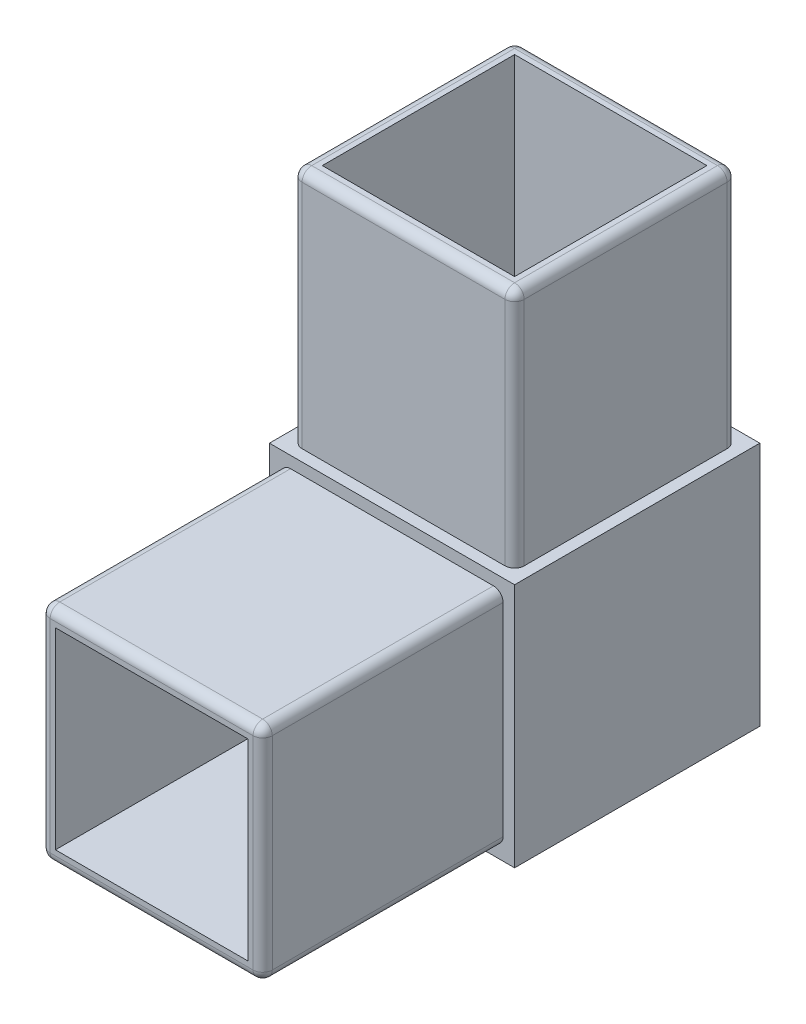
from build123d import *

# Parameters (mm, degrees)
SKETCH1_W           = 25.5
SKETCH1_H           = 25.5
BOSS_EXTRUDE1_DEPTH = 25.5
SKETCH3_W           = 23.1
SKETCH3_H           = 23.1
BOSS_EXTRUDE2_DEPTH = 25
SKETCH5_W           = 23.1
SKETCH5_H           = 23.1
BOSS_EXTRUDE3_DEPTH = 25
SKETCH6_W           = 20
SKETCH6_H           = 20
CUT_EXTRUDE1_DEPTH  = 45.5
SKETCH7_W           = 20
SKETCH7_H           = 20
CUT_EXTRUDE2_DEPTH  = 45.5
FILLET1_R           = 1


with BuildPart() as part:
    # Sketch1 → Boss-Extrude1 (new body)
    with BuildSketch(Plane(origin=(0, 0, 0), x_dir=(1, 0, 0), z_dir=(0, 1, 0))):
        Rectangle(SKETCH1_W, SKETCH1_H)
    extrude(amount=BOSS_EXTRUDE1_DEPTH)

    # Sketch3 → Boss-Extrude2 (add)
    with BuildSketch(Plane(origin=(0, 25.5, 0), x_dir=(1, 0, 0), z_dir=(0, 1, 0))):
        Rectangle(SKETCH3_W, SKETCH3_H)
    extrude(amount=BOSS_EXTRUDE2_DEPTH)

    # Sketch5 → Boss-Extrude3 (add)
    with BuildSketch(Plane.XY.offset(12.75)):
        with Locations((0, 12.75)):
            Rectangle(SKETCH5_W, SKETCH5_H)
    extrude(amount=BOSS_EXTRUDE3_DEPTH)

    # Sketch6 → Cut-Extrude1 (cut)
    with BuildSketch(Plane.XY.offset(37.75)):
        with Locations((0, 12.75)):
            Rectangle(SKETCH6_W, SKETCH6_H)
    extrude(amount=-CUT_EXTRUDE1_DEPTH, mode=Mode.SUBTRACT)

    # Sketch7 → Cut-Extrude2 (cut)
    with BuildSketch(Plane(origin=(0, 50.5, 0), x_dir=(1, 0, 0), z_dir=(0, 1, 0))):
        Rectangle(SKETCH7_W, SKETCH7_H)
    extrude(amount=-CUT_EXTRUDE2_DEPTH, mode=Mode.SUBTRACT)

    # Fillet1
    fillet1_edges = [part.edges().sort_by_distance(p)[0] for p in [
        (0, 1.2, 37.75),
        (-11.55, 12.75, 37.75),
        (11.55, 12.75, 37.75),
        (0, 24.3, 37.75),
        (-11.55, 50.5, 0),
        (0, 50.5, -11.55),
        (11.55, 50.5, 0),
        (0, 50.5, 11.55),
        (11.55, 1.2, 25.25),
        (-11.55, 1.2, 25.25),
        (-11.55, 24.3, 25.25),
        (11.55, 24.3, 25.25),
        (-11.55, 38, 11.55),
        (-11.55, 38, -11.55),
        (11.55, 38, -11.55),
        (11.55, 38, 11.55),
    ]]
    fillet(fillet1_edges, radius=FILLET1_R)


solid = part.part
